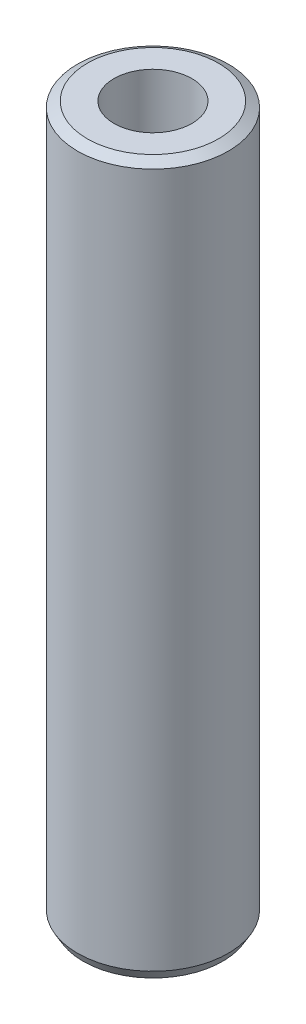
from build123d import *
from OCP.BRepFilletAPI import BRepFilletAPI_MakeChamfer

# Parameters (mm, degrees)
SKETCH1_R           = 45
BOSS_EXTRUDE1_DEPTH = 423.675249343
SKETCH2_R           = 23.234471386
CUT_EXTRUDE1_DEPTH  = 429.428193407
CHAMFER1_SIZE       = 3.393342045
CHAMFER1_SIZE2      = 5.877440829


with BuildPart() as part:
    # Sketch1 → Boss-Extrude1 (new body)
    with BuildSketch(Plane(origin=(0, 0, 0), x_dir=(1, 0, 0), z_dir=(0, 1, 0))):
        Circle(SKETCH1_R)
    extrude(amount=BOSS_EXTRUDE1_DEPTH)

    # Sketch2 → Cut-Extrude1 (cut, through all)
    with BuildSketch(Plane(origin=(0, 0, 0), x_dir=(1, 0, 0), z_dir=(0, 1, 0))):
        Circle(SKETCH2_R)
    extrude(amount=CUT_EXTRUDE1_DEPTH, mode=Mode.SUBTRACT)

    # Chamfer1: one chamfer whose edges measure the first distance from different faces: ONE call of the kernel's chamfer builder (chamfer() names one face for all edges)
    chamfer1_edges_1 = [part.edges().sort_by_distance(p)[0] for p in [
        (-45, 423.675249343, 0),
    ]]
    chamfer1_side_1 = [part.faces().sort_by_distance(p)[0] for p in [
        (-45, 211.837624671, 0),
    ]]
    chamfer1_edges_2 = [part.edges().sort_by_distance(p)[0] for p in [
        (-45, 0, 0),
    ]]
    chamfer1_side_2 = [part.faces().sort_by_distance(p)[0] for p in [
        (-43.727207794, 0, 0),
    ]]
    chamfer1 = BRepFilletAPI_MakeChamfer(part.part.solid().wrapped)
    for e in chamfer1_edges_1:
        chamfer1.Add(CHAMFER1_SIZE, CHAMFER1_SIZE2, e.wrapped, chamfer1_side_1[0].wrapped)  # the first distance lies on this face
    for e in chamfer1_edges_2:
        chamfer1.Add(CHAMFER1_SIZE, CHAMFER1_SIZE2, e.wrapped, chamfer1_side_2[0].wrapped)  # the first distance lies on this face
    add(Compound.cast(chamfer1.Shape()), mode=Mode.REPLACE)


solid = part.part
